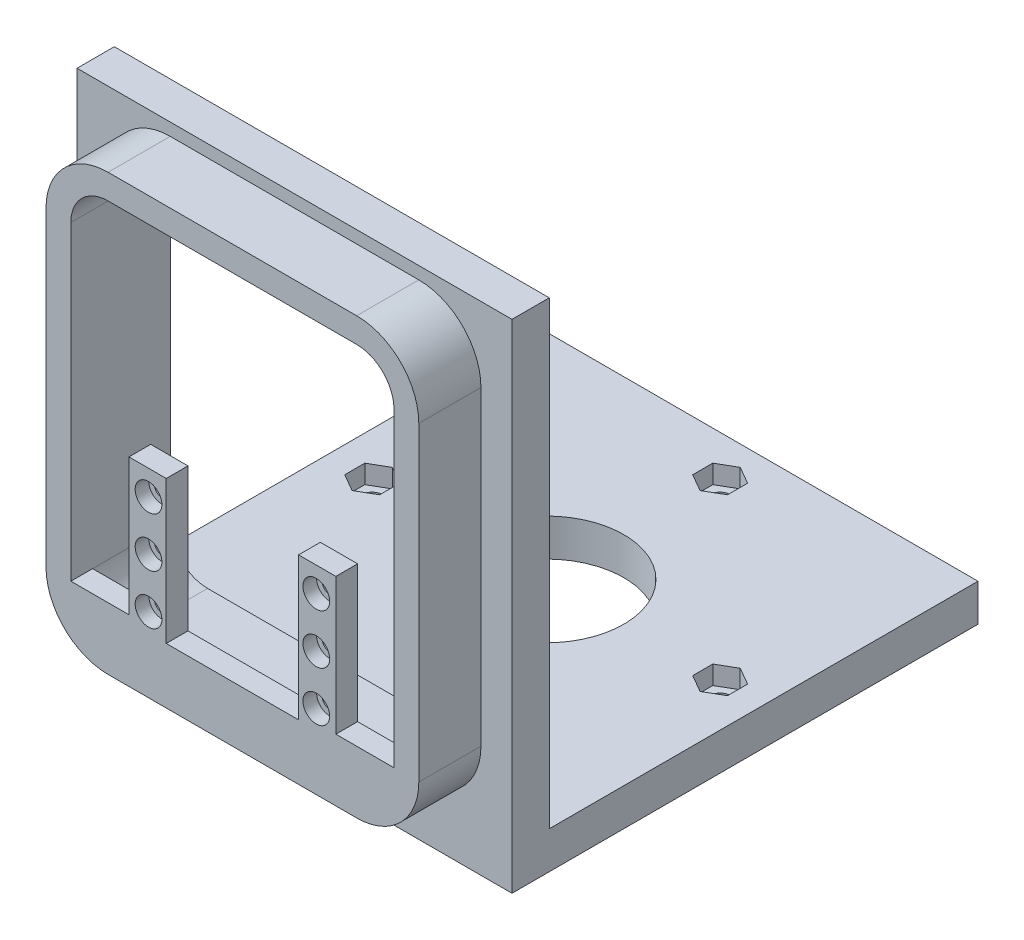
from build123d import *

# Parameters (mm, degrees)
BOSS_EXTRUDE1_DEPTH = 10
SKETCH10_W          = 70
SKETCH10_H          = 80
BOSS_EXTRUDE6_DEPTH = 75
CUT_EXTRUDE7_DEPTH  = 46
SKETCH15_R          = 1.25
BOSS_EXTRUDE7_DEPTH = 3.5
SKETCH17_R          = 2.15
CUT_EXTRUDE9_DEPTH  = 2.2
SKETCH19_W          = 69
SKETCH19_H          = 74
CUT_EXTRUDE11_DEPTH = 70
SKETCH20_R          = 1.65
CUT_EXTRUDE12_DEPTH = 10
SKETCH21_R          = 12.5
CUT_EXTRUDE13_DEPTH = 10
CUT_EXTRUDE14_DEPTH = 3


with BuildPart() as part:
    # Sketch1 → Boss-Extrude1 (new body)
    with BuildSketch(Plane.XY):
        with BuildLine():
            Line((-20, -35), (20, -35))
            ThreePointArc((20, -35), (27.071067812, -32.071067812), (30, -25))
            Line((30, -25), (30, 25))
            ThreePointArc((30, 25), (27.071067812, 32.071067812), (20, 35))
            Line((20, 35), (-20, 35))
            ThreePointArc((-20, 35), (-27.071067812, 32.071067812), (-30, 25))
            Line((-30, 25), (-30, -25))
            ThreePointArc((-30, -25), (-27.071067812, -32.071067812), (-20, -35))
        make_face()
    extrude(amount=-BOSS_EXTRUDE1_DEPTH)

    # Sketch10 → Boss-Extrude6 (add)
    with BuildSketch(Plane(origin=(0, 0, -10), x_dir=(-1, 0, 0), z_dir=(0, 0, -1))):
        with Locations((0, -3)):
            Rectangle(SKETCH10_W, SKETCH10_H)
    extrude(amount=BOSS_EXTRUDE6_DEPTH)

    # Sketch14 → Cut-Extrude7 (cut)
    with BuildSketch(Plane.XY):
        with BuildLine():
            Line((20, 31), (-20, 31))
            ThreePointArc((-20, 31), (-24.242640687, 29.242640687), (-26, 25))
            Line((-26, 25), (-26, -25))
            ThreePointArc((-26, -25), (-24.242640687, -29.242640687), (-20, -31))
            Line((-20, -31), (20, -31))
            ThreePointArc((20, -31), (24.242640687, -29.242640687), (26, -25))
            Line((26, -25), (26, 25))
            ThreePointArc((26, 25), (24.242640687, 29.242640687), (20, 31))
        make_face()
    extrude(amount=-CUT_EXTRUDE7_DEPTH, mode=Mode.SUBTRACT)

    # Sketch15 → Boss-Extrude7 (add)
    with BuildSketch(Plane.XY):
        with BuildLine():
            Line((-16.65, -3), (-10.65, -3))
            Line((-10.65, -3), (-10.65, -26))
            Line((-10.65, -26), (10.65, -26))
            Line((10.65, -26), (10.65, -3))
            Line((10.65, -3), (16.65, -3))
            Line((16.65, -3), (16.65, -25))
            Line((16.65, -25), (26, -25))
            ThreePointArc((26, -25), (24.242640687, -29.242640687), (20, -31))
            Line((20, -31), (-20, -31))
            ThreePointArc((-20, -31), (-24.242640687, -29.242640687), (-26, -25))
            Line((-26, -25), (-16.65, -25))
            Line((-16.65, -25), (-16.65, -3))
        make_face()
        with Locations((13.5, -7)):
            Circle(SKETCH15_R, mode=Mode.SUBTRACT)
        with Locations((13.5, -15)):
            Circle(SKETCH15_R, mode=Mode.SUBTRACT)
        with Locations((13.5, -23)):
            Circle(SKETCH15_R, mode=Mode.SUBTRACT)
        with Locations((-13.5, -7)):
            Circle(SKETCH15_R, mode=Mode.SUBTRACT)
        with Locations((-13.5, -15)):
            Circle(SKETCH15_R, mode=Mode.SUBTRACT)
        with Locations((-13.5, -23)):
            Circle(SKETCH15_R, mode=Mode.SUBTRACT)
    extrude(amount=-BOSS_EXTRUDE7_DEPTH)

    # Sketch17 → Cut-Extrude9 (cut)
    with BuildSketch(Plane.XY):
        with Locations((-13.5, -7)):
            Circle(SKETCH17_R)
        with Locations((-13.5, -15)):
            Circle(SKETCH17_R)
        with Locations((-13.5, -23)):
            Circle(SKETCH17_R)
        with Locations((13.5, -7)):
            Circle(SKETCH17_R)
        with Locations((13.5, -15)):
            Circle(SKETCH17_R)
        with Locations((13.5, -23)):
            Circle(SKETCH17_R)
    extrude(amount=-CUT_EXTRUDE9_DEPTH, mode=Mode.SUBTRACT)

    # Sketch19 → Cut-Extrude11 (cut)
    with BuildSketch(Plane(origin=(35, 0, 0), x_dir=(0, 0, -1), z_dir=(1, 0, 0))):
        with Locations((50.5, 0)):
            Rectangle(SKETCH19_W, SKETCH19_H)
    extrude(amount=-CUT_EXTRUDE11_DEPTH, mode=Mode.SUBTRACT)

    # Sketch20 → Cut-Extrude12 (cut)
    with BuildSketch(Plane.XZ.offset(43)):
        with Locations((28, -50.5)):
            Circle(SKETCH20_R)
        with Locations((0, -78.5)):
            Circle(SKETCH20_R)
        with Locations((-28, -50.5)):
            Circle(SKETCH20_R)
    extrude(amount=-CUT_EXTRUDE12_DEPTH, mode=Mode.SUBTRACT)

    # Sketch21 → Cut-Extrude13 (cut)
    with BuildSketch(Plane(origin=(0, -37, 0), x_dir=(1, 0, 0), z_dir=(0, 1, 0))):
        with Locations((0, 50.5)):
            Circle(SKETCH21_R)
    extrude(amount=-CUT_EXTRUDE13_DEPTH, mode=Mode.SUBTRACT)

    # Sketch22 → Cut-Extrude14 (cut)
    with BuildSketch(Plane(origin=(0, -37, 0), x_dir=(1, 0, 0), z_dir=(0, 1, 0))):
        Polygon((0, 81.733161507), (-2.8, 80.116580754), (-2.8, 76.883419246), (0, 75.266838493), (2.8, 76.883419246), (2.8, 80.116580754), align=None)
        Polygon((-30.8, 48.883419246), (-28, 47.266838493), (-25.2, 48.883419246), (-25.2, 52.116580754), (-28, 53.733161507), (-30.8, 52.116580754), align=None)
        Polygon((28, 53.733161507), (25.2, 52.116580754), (25.2, 48.883419246), (28, 47.266838493), (30.8, 48.883419246), (30.8, 52.116580754), align=None)
    extrude(amount=-CUT_EXTRUDE14_DEPTH, mode=Mode.SUBTRACT)


solid = part.part
